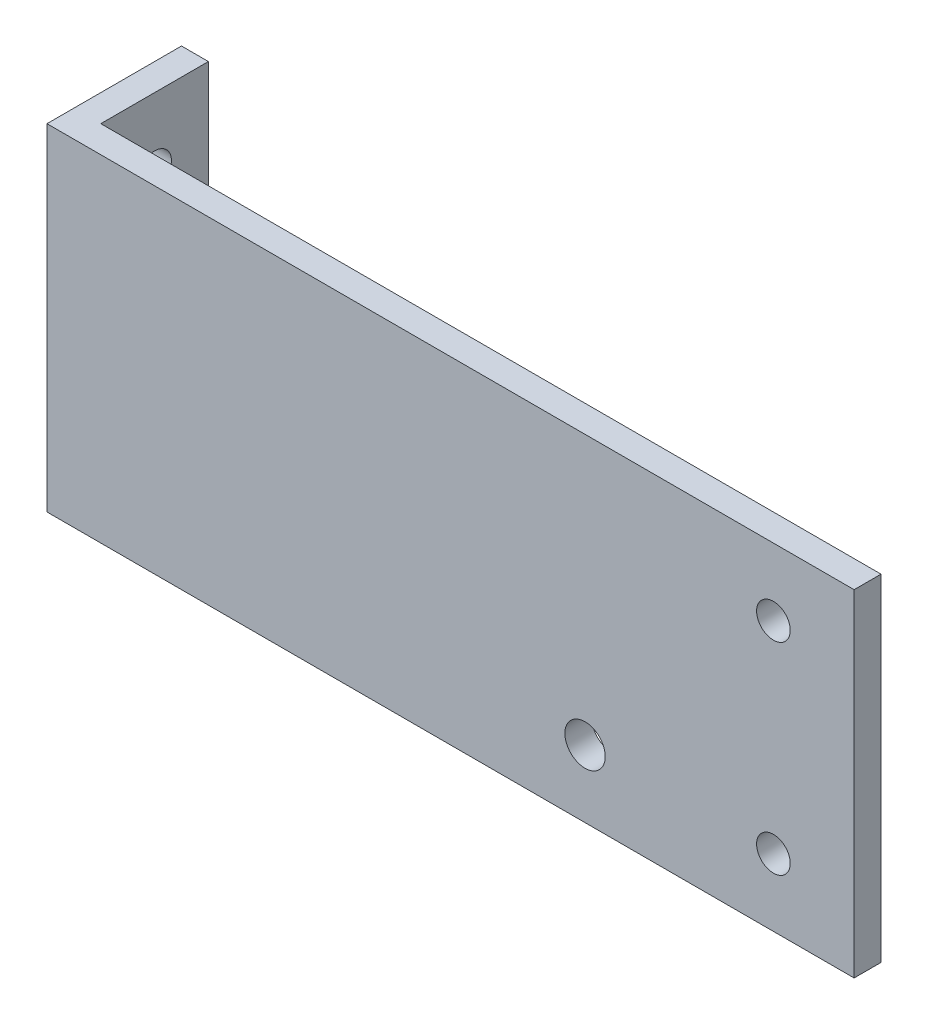
from build123d import *

# Parameters (mm, degrees)
EXTRUDE_1_DEPTH     = 50
SKETCH_2_R          = 2.5
CUT_EXTRUDE_1_DEPTH = 10
SKETCH_3_R          = 2.5
SKETCH_3_R_2        = 3
CUT_EXTRUDE_2_DEPTH = 10


with BuildPart() as part:
    # Эскиз1 → Бобышка-Вытянуть1 (new body)
    with BuildSketch(Plane(origin=(0, 0, 0), x_dir=(1, 0, 0), z_dir=(0, 1, 0))):
        Polygon((0, 0), (120, 0), (120, 4), (4, 4), (4, 20), (0, 20), (0, 4), align=None)
    extrude(amount=EXTRUDE_1_DEPTH)

    # Эскиз2 → Вырез-Вытянуть1 (cut)
    with BuildSketch(Plane.ZY):
        with Locations((-12, 40)):
            Circle(SKETCH_2_R)
        with Locations((-12, 10)):
            Circle(SKETCH_2_R)
    extrude(amount=-CUT_EXTRUDE_1_DEPTH, mode=Mode.SUBTRACT)

    # Эскиз3 → Вырез-Вытянуть2 (cut)
    with BuildSketch(Plane.XY):
        with Locations((108, 40)):
            Circle(SKETCH_3_R)
        with Locations((108, 10)):
            Circle(SKETCH_3_R)
        with Locations((80, 10)):
            Circle(SKETCH_3_R_2)
    extrude(amount=-CUT_EXTRUDE_2_DEPTH, mode=Mode.SUBTRACT)


solid = part.part
